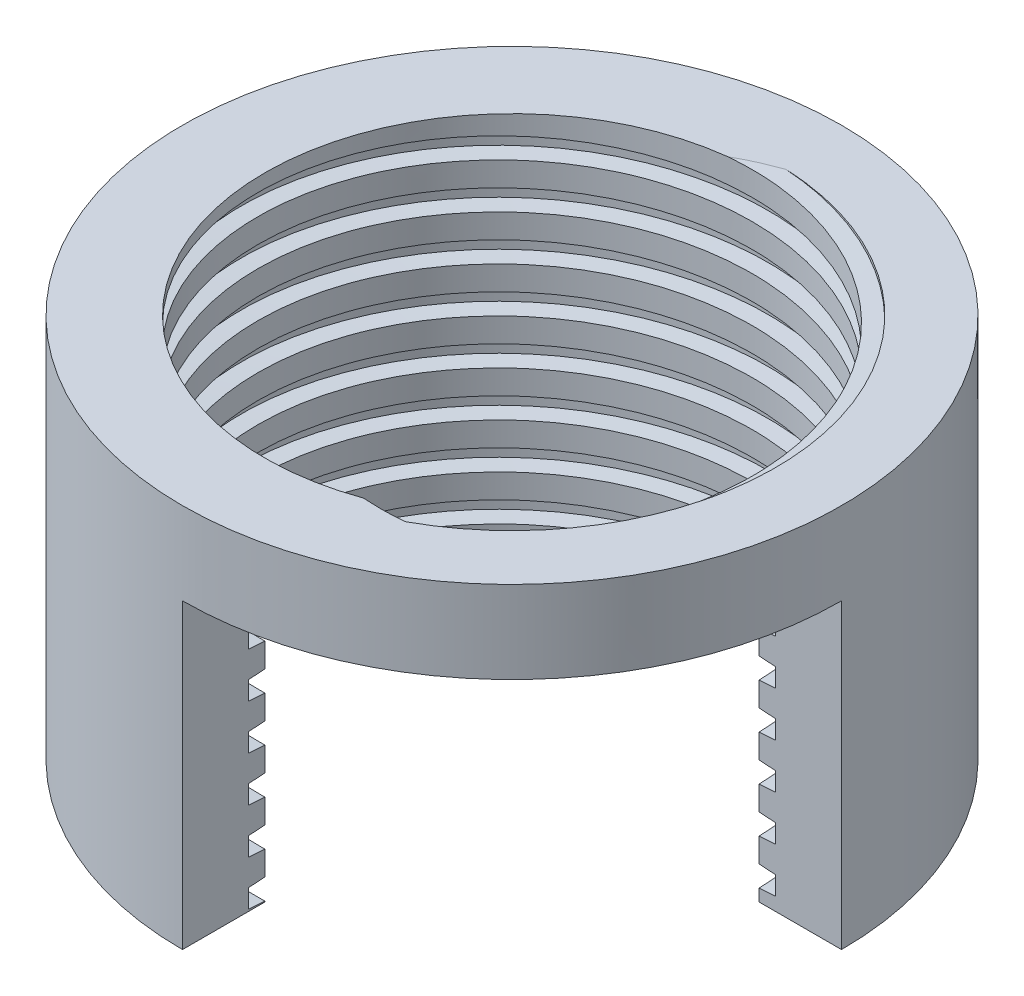
from build123d import *

# Parameters (mm, degrees)
SKETCH2_R           = 6
SKETCH2_R_2         = 4.5
BOSS_EXTRUDE1_DEPTH = 7
CUT_SWEEP1_PITCH    = 0.82
CUTOUT_DEPTH        = 5.5


with BuildPart() as part:
    # Sketch2 → Boss-Extrude1 (new body)
    with BuildSketch(Plane(origin=(0, 0, 0), x_dir=(1, 0, 0), z_dir=(0, 1, 0))):
        with Locations(Location((0, 0, 0), (0, 0, 270))):
            Circle(SKETCH2_R)
        with Locations(Location((0, 0, 0), (0, 0, 270))):
            Circle(SKETCH2_R_2, mode=Mode.SUBTRACT)
    extrude(amount=BOSS_EXTRUDE1_DEPTH)

    # Cut-Sweep1: arcs per turn and ends read off the stored shape
    # Cut-Sweep1: the profile of Sketch3 profile screwed along a right-hand helix through 10.5 turns, 8 arcs to a turn; built about Z, then put on its axis
    cut_sweep1_z = Axis((0, 0, 0), (0, 0, 1))
    cut_sweep1_corners = [(4.8, 0, -0.99), (4.8, 0, -0.65), (4.4997, 0, -0.62998), (4.4997, 0, -1.01002)]
    with BuildLine(mode=Mode.PRIVATE) as cut_sweep1_profile:
        Line(cut_sweep1_corners[0], cut_sweep1_corners[1])
        Line(cut_sweep1_corners[1], cut_sweep1_corners[2])
        Line(cut_sweep1_corners[2], cut_sweep1_corners[3])
        Line(cut_sweep1_corners[3], cut_sweep1_corners[0])
    cut_sweep1_cap = Face(cut_sweep1_profile.wire())
    cut_sweep1_turn_angles = [0, 22.5, 45, 67.5, 90, 112.5, 135, 157.5, 180, 202.5, 225, 247.5, 270, 292.5, 315, 337.5, 360]
    cut_sweep1_turn_weights = [1, 0.9238795325112867, 1, 0.9238795325112867, 1, 0.9238795325112867, 1, 0.9238795325112867, 1, 0.9238795325112867, 1, 0.9238795325112867, 1, 0.9238795325112867, 1, 0.9238795325112867, 1]
    cut_sweep1_turn_rails = [Edge.make_bspline([Vector(p[0], p[1], 0).rotate(cut_sweep1_z, cut_sweep1_turn_angles[k]) / cut_sweep1_turn_weights[k] + Vector(0, 0, p[2] + CUT_SWEEP1_PITCH * cut_sweep1_turn_angles[k] / 360) for k in range(17)], [0, 0, 0, 1, 1, 2, 2, 3, 3, 4, 4, 5, 5, 6, 6, 7, 7, 8, 8, 8], 2, cut_sweep1_turn_weights) for p in cut_sweep1_corners]
    cut_sweep1_turn_sides = [Face.make_surface_from_curves(cut_sweep1_turn_rails[p[0]], cut_sweep1_turn_rails[p[1]]) for p in [(0, 1), (1, 2), (2, 3), (3, 0)]]
    cut_sweep1_last_angles = [3600, 3622.5, 3645, 3667.5, 3690, 3712.5, 3735, 3757.5, 3780]
    cut_sweep1_last_weights = [1, 0.9238795325112867, 1, 0.9238795325112867, 1, 0.9238795325112867, 1, 0.9238795325112867, 1]
    cut_sweep1_last_rails = [Edge.make_bspline([Vector(p[0], p[1], 0).rotate(cut_sweep1_z, cut_sweep1_last_angles[k]) / cut_sweep1_last_weights[k] + Vector(0, 0, p[2] + CUT_SWEEP1_PITCH * cut_sweep1_last_angles[k] / 360) for k in range(9)], [0, 0, 0, 1, 1, 2, 2, 3, 3, 4, 4, 4], 2, cut_sweep1_last_weights) for p in cut_sweep1_corners]
    cut_sweep1_last_sides = [Face.make_surface_from_curves(cut_sweep1_last_rails[p[0]], cut_sweep1_last_rails[p[1]]) for p in [(0, 1), (1, 2), (2, 3), (3, 0)]]
    cut_sweep1 = Plane(origin=(0, 0, 0), x_dir=(-1, 0, 0), z_dir=(0, 1, 0)) * Solid(Shell([*[p.moved(Location((0, 0, CUT_SWEEP1_PITCH * i))) for i in range(10) for p in cut_sweep1_turn_sides], *cut_sweep1_last_sides, cut_sweep1_cap, cut_sweep1_cap.rotate(cut_sweep1_z, 3780).moved(Location((0, 0, CUT_SWEEP1_PITCH * 3780 / 360)))]))
    add(cut_sweep1, mode=Mode.SUBTRACT)

    # Sketch6 → cutout (cut)
    with BuildSketch(Plane(origin=(0, 0, 0), x_dir=(1, 0, 0), z_dir=(0, 1, 0))):
        with BuildLine():
            Line((0, 0), (7, 0))
            ThreePointArc((7, 0), (4.949747468, -4.949747468), (0, -7))
            Line((0, -7), (0, 0))
        make_face()
    extrude(amount=CUTOUT_DEPTH, mode=Mode.SUBTRACT)


solid = part.part
